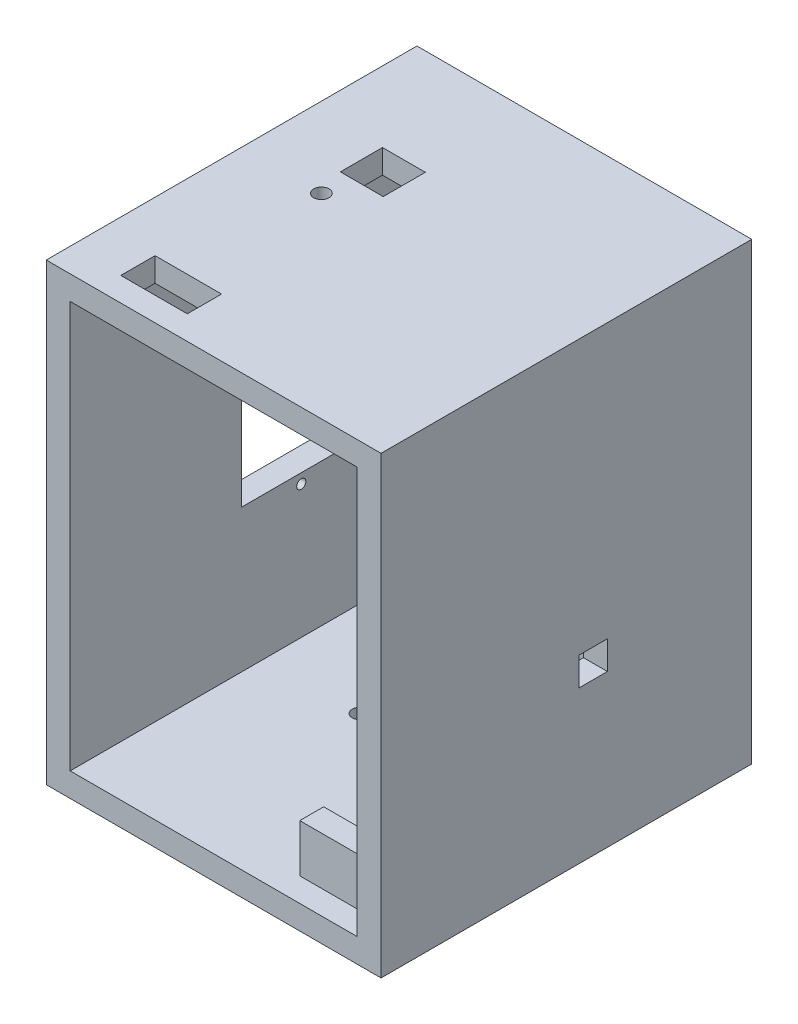
from build123d import *

# Parameters (mm, degrees)
SKETCH1_W           = 70
SKETCH1_H           = 95
SKETCH1_W_2         = 60
SKETCH1_H_2         = 85
BOSS_EXTRUDE1_DEPTH = 75
SKETCH2_R           = 0.9525
SKETCH2_W           = 24.987
SKETCH2_H           = 25.114
CUT_EXTRUDE1_DEPTH  = 27
SKETCH3_W           = 8.9596
SKETCH3_H           = 8.8072
SKETCH3_W_2         = 13.9
SKETCH3_H_2         = 7.1628
SKETCH3_R           = 1.6129
CUT_EXTRUDE2_DEPTH  = 27
SKETCH4_W           = 5.937
SKETCH4_H           = 5.937
CUT_EXTRUDE3_DEPTH  = 27
SKETCH5_W           = 5
SKETCH5_H           = 53.1368
SKETCH5_H_2         = 10
BOSS_EXTRUDE2_DEPTH = 17
SKETCH6_W           = 4.6048
SKETCH6_H           = 23.1368
BOSS_EXTRUDE3_DEPTH = 17
SKETCH7_R           = 1.27
CUT_EXTRUDE4_DEPTH  = 17
SKETCH8_R           = 5.969
SKETCH8_R_2         = 1.5875
CUT_EXTRUDE5_DEPTH  = 17
SKETCH9_W           = 70
SKETCH9_H           = 95
BOSS_EXTRUDE4_DEPTH = 2.5
SKETCH10_R          = 5.572
SKETCH10_R_2        = 1.778
CUT_EXTRUDE7_DEPTH  = 24


with BuildPart() as part:
    # Sketch1 → Boss-Extrude1 (new body)
    with BuildSketch(Plane.XY):
        with Locations((17.4651, -16.973)):
            Rectangle(SKETCH1_W, SKETCH1_H)
        with Locations((17.4651, -16.973)):
            Rectangle(SKETCH1_W_2, SKETCH1_H_2, mode=Mode.SUBTRACT)
    extrude(amount=-BOSS_EXTRUDE1_DEPTH)

    # Sketch2 → Cut-Extrude1 (cut)
    with BuildSketch(Plane.ZY.offset(17.5349)):
        with Locations((-48.317437652, -2.477242629)):
            Circle(SKETCH2_R)
        with Locations((-48.317437652, -31.687242629)):
            Circle(SKETCH2_R)
        with Locations((-48.317437652, -17.082242629)):
            Rectangle(SKETCH2_W, SKETCH2_H)
    extrude(amount=-CUT_EXTRUDE1_DEPTH, mode=Mode.SUBTRACT)

    # Sketch3 → Cut-Extrude2 (cut)
    with BuildSketch(Plane(origin=(0, 30.527, 0), x_dir=(1, 0, 0), z_dir=(0, 1, 0))):
        with Locations((1.726886505, 51.110634366)):
            Rectangle(SKETCH3_W, SKETCH3_H)
        with Locations((0, 8.5814)):
            Rectangle(SKETCH3_W_2, SKETCH3_H_2)
        with Locations((-0.851213495, 40.836334366)):
            Circle(SKETCH3_R)
    extrude(amount=-CUT_EXTRUDE2_DEPTH, mode=Mode.SUBTRACT)

    # Sketch4 → Cut-Extrude3 (cut)
    with BuildSketch(Plane(origin=(52.4651, 0, 0), x_dir=(0, 0, -1), z_dir=(1, 0, 0))):
        with Locations((44.3573, -29.674429677)):
            Rectangle(SKETCH4_W, SKETCH4_H)
    extrude(amount=-CUT_EXTRUDE3_DEPTH, mode=Mode.SUBTRACT)

    # Sketch5 → Boss-Extrude2 (add)
    with BuildSketch(Plane.ZY.offset(-47.4651)):
        with Locations((-35.9772, -21.355929677)):
            Rectangle(SKETCH5_W, SKETCH5_H)
        with Locations((-7.5, -54.473)):
            Rectangle(SKETCH5_W, SKETCH5_H_2)
    extrude(amount=BOSS_EXTRUDE2_DEPTH)

    # Sketch6 → Boss-Extrude3 (add)
    with BuildSketch(Plane(origin=(0, 0, -38.4772), x_dir=(-1, 0, 0), z_dir=(0, 0, -1))):
        with Locations((-32.7675, -21.355929677)):
            Rectangle(SKETCH6_W, SKETCH6_H)
    extrude(amount=BOSS_EXTRUDE3_DEPTH)

    # Sketch7 → Cut-Extrude4 (cut)
    with BuildSketch(Plane(origin=(0, 0, -10), x_dir=(-1, 0, 0), z_dir=(0, 0, -1))):
        with Locations((-43.6551, -55.663)):
            Circle(SKETCH7_R)
    extrude(amount=-CUT_EXTRUDE4_DEPTH, mode=Mode.SUBTRACT)

    # Sketch8 → Cut-Extrude5 (cut)
    with BuildSketch(Plane.XZ.offset(64.473)):
        with Locations((7.349574464, -49.560083292)):
            Circle(SKETCH8_R)
        with Locations((7.349574464, -40.670083292)):
            Circle(SKETCH8_R_2)
    extrude(amount=-CUT_EXTRUDE5_DEPTH, mode=Mode.SUBTRACT)

    # Sketch9 → Boss-Extrude4 (add, symmetric)
    with BuildSketch(Plane(origin=(0, 0, -75), x_dir=(-1, 0, 0), z_dir=(0, 0, -1))):
        with Locations((-17.4651, -16.973)):
            Rectangle(SKETCH9_W, SKETCH9_H)
    extrude(amount=BOSS_EXTRUDE4_DEPTH, both=True)

    # Sketch10 → Cut-Extrude7 (cut)
    with BuildSketch(Plane(origin=(0, 0, -77.5), x_dir=(-1, 0, 0), z_dir=(0, 0, -1))):
        with Locations((-19.613463313, 13.023288788)):
            Circle(SKETCH10_R)
        with Locations((-19.613463313, 0.958288788)):
            Circle(SKETCH10_R)
        with Locations((-19.613463313, -11.106711212)):
            Circle(SKETCH10_R)
        with Locations((-27.360463313, -31.617211212)):
            Circle(SKETCH10_R_2)
        with Locations((-11.866463313, -31.617211212)):
            Circle(SKETCH10_R_2)
    extrude(amount=-CUT_EXTRUDE7_DEPTH, mode=Mode.SUBTRACT)


solid = part.part
